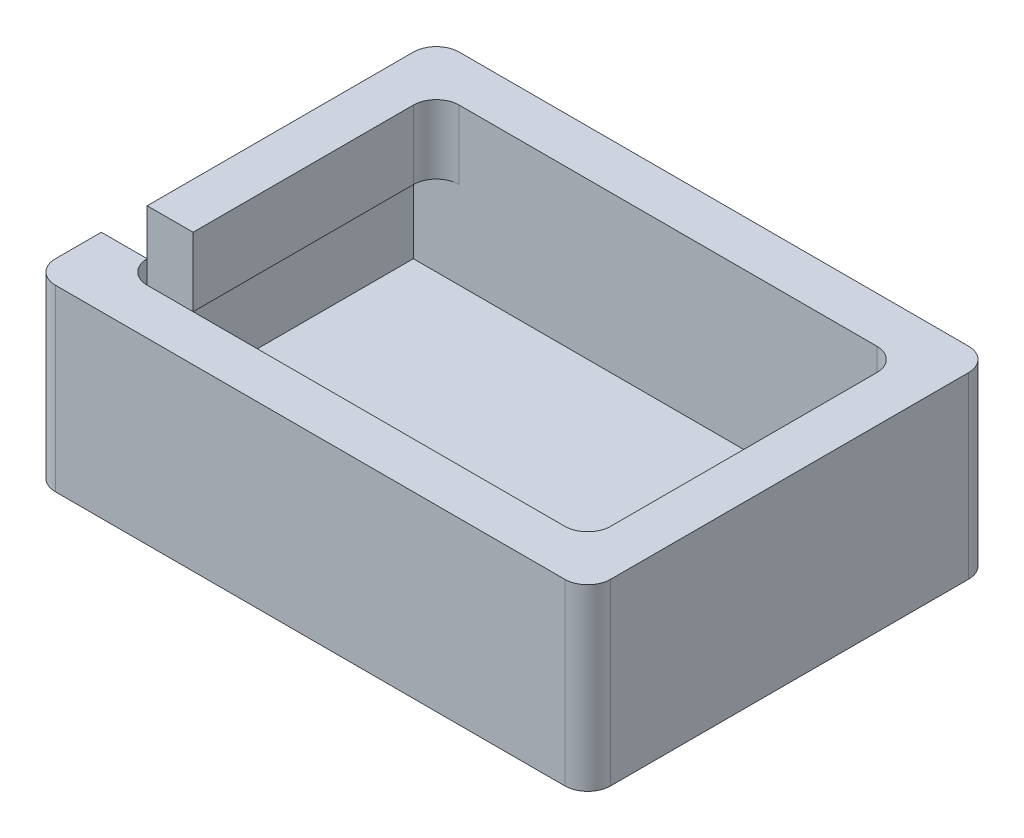
from build123d import *

# Parameters (mm, degrees)
CROQUIS1_W              = 121
CROQUIS1_H              = 88
CROQUIS1_W_2            = 101
CROQUIS1_H_2            = 68
SALIENTE_EXTRUIR1_DEPTH = 15
CROQUIS2_W              = 121
CROQUIS2_H              = 88
CROQUIS2_W_2            = 111
CROQUIS2_H_2            = 68
SALIENTE_EXTRUIR2_DEPTH = 19
REDONDEO1_R             = 5
REDONDEO2_R             = 5
CROQUIS3_W              = 10
CROQUIS3_H              = 15
CORTAR_EXTRUIR1_DEPTH   = 78.183223566
SALIENTE_EXTRUIR3_DEPTH = 5


with BuildPart() as part:
    # Croquis1 → Saliente-Extruir1 (new body)
    with BuildSketch(Plane(origin=(0, 0, 0), x_dir=(1, 0, 0), z_dir=(0, 1, 0))):
        Rectangle(CROQUIS1_W, CROQUIS1_H)
        Rectangle(CROQUIS1_W_2, CROQUIS1_H_2, mode=Mode.SUBTRACT)
    extrude(amount=SALIENTE_EXTRUIR1_DEPTH)

    # Croquis2 → Saliente-Extruir2 (add)
    with BuildSketch(Plane(origin=(0, 0, 0), x_dir=(1, 0, 0), z_dir=(0, 1, 0))):
        Rectangle(CROQUIS2_W, CROQUIS2_H)
        Rectangle(CROQUIS2_W_2, CROQUIS2_H_2, mode=Mode.SUBTRACT)
    extrude(amount=-SALIENTE_EXTRUIR2_DEPTH)

    # Redondeo1
    redondeo1_edges = [part.edges().sort_by_distance(p)[0] for p in [
        (50.5, 7.5, 34),
        (50.5, 7.5, -34),
        (-50.5, 7.5, -34),
        (-50.5, 7.5, 34),
    ]]
    fillet(redondeo1_edges, radius=REDONDEO1_R)

    # Redondeo2
    redondeo2_edges = [part.edges().sort_by_distance(p)[0] for p in [
        (-60.5, -2, 44),
        (-60.5, -2, -44),
        (60.5, -2, -44),
        (60.5, -2, 44),
    ]]
    fillet(redondeo2_edges, radius=REDONDEO2_R)

    # Croquis3 → Cortar-Extruir1 (cut, through all)
    with BuildSketch(Plane(origin=(0, 0, 0), x_dir=(0, 0, -1), z_dir=(1, 0, 0))):
        with Locations((-24, 7.5)):
            Rectangle(CROQUIS3_W, CROQUIS3_H)
    extrude(amount=-CORTAR_EXTRUIR1_DEPTH, mode=Mode.SUBTRACT)

    # Croquis4 → Saliente-Extruir3 (add)
    with BuildSketch(Plane.XZ.offset(19)):
        with BuildLine():
            Line((55.5, 44), (-55.5, 44))
            ThreePointArc((-55.5, 44), (-59.035533906, 42.535533906), (-60.5, 39))
            Line((-60.5, 39), (-60.5, -39))
            ThreePointArc((-60.5, -39), (-59.035533906, -42.535533906), (-55.5, -44))
            Line((-55.5, -44), (55.5, -44))
            ThreePointArc((55.5, -44), (59.035533906, -42.535533906), (60.5, -39))
            Line((60.5, -39), (60.5, 39))
            ThreePointArc((60.5, 39), (59.035533906, 42.535533906), (55.5, 44))
        make_face()
    extrude(amount=SALIENTE_EXTRUIR3_DEPTH)


solid = part.part
